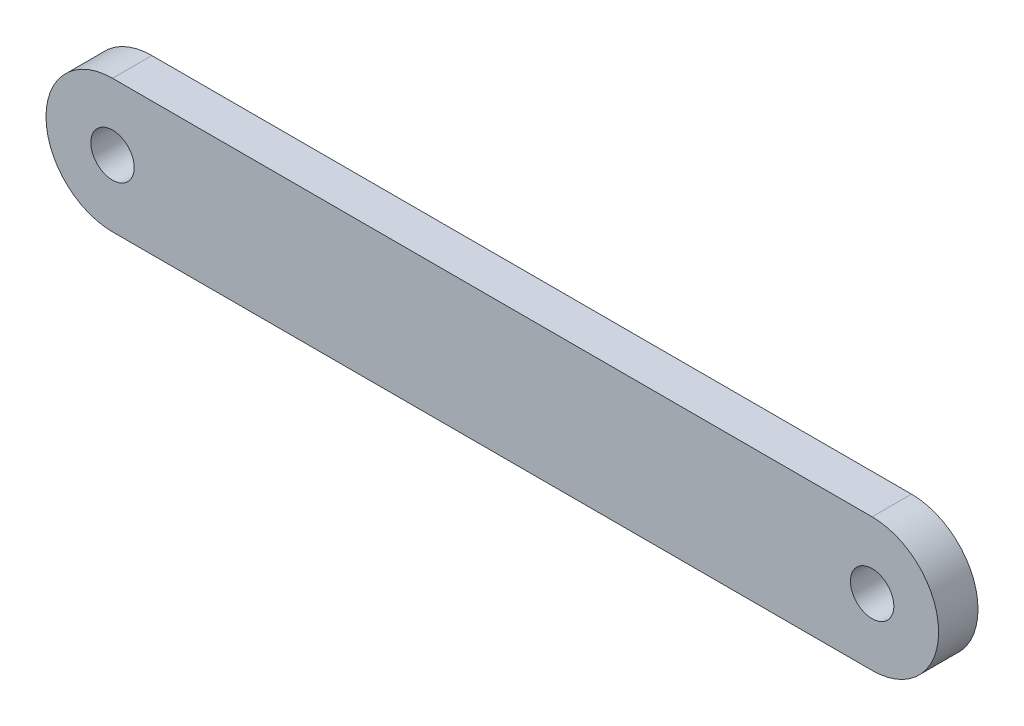
from build123d import *

# Parameters (mm, degrees)
SKETCH2_R           = 1.75
BOSS_EXTRUDE1_DEPTH = 3.175


with BuildPart() as part:
    # Sketch2 → Boss-Extrude1 (new body)
    with BuildSketch(Plane(origin=(0, 0, 0), x_dir=(-1, 0, 0), z_dir=(0, 0, -1))):
        with BuildLine():
            Line((-30.629163068, 54.187764621), (30.629163068, 54.187764621))
            ThreePointArc((30.629163068, 54.187764621), (35.993326137, 48.823601552), (30.629163068, 43.459438484))
            Line((30.629163068, 43.459438484), (-30.629163068, 43.459438484))
            ThreePointArc((-30.629163068, 43.459438484), (-35.993326137, 48.823601552), (-30.629163068, 54.187764621))
        make_face()
        with Locations((-30.629163068, 48.823601552)):
            Circle(SKETCH2_R, mode=Mode.SUBTRACT)
        with Locations((30.629163068, 48.823601552)):
            Circle(SKETCH2_R, mode=Mode.SUBTRACT)
    extrude(amount=BOSS_EXTRUDE1_DEPTH)


solid = part.part
